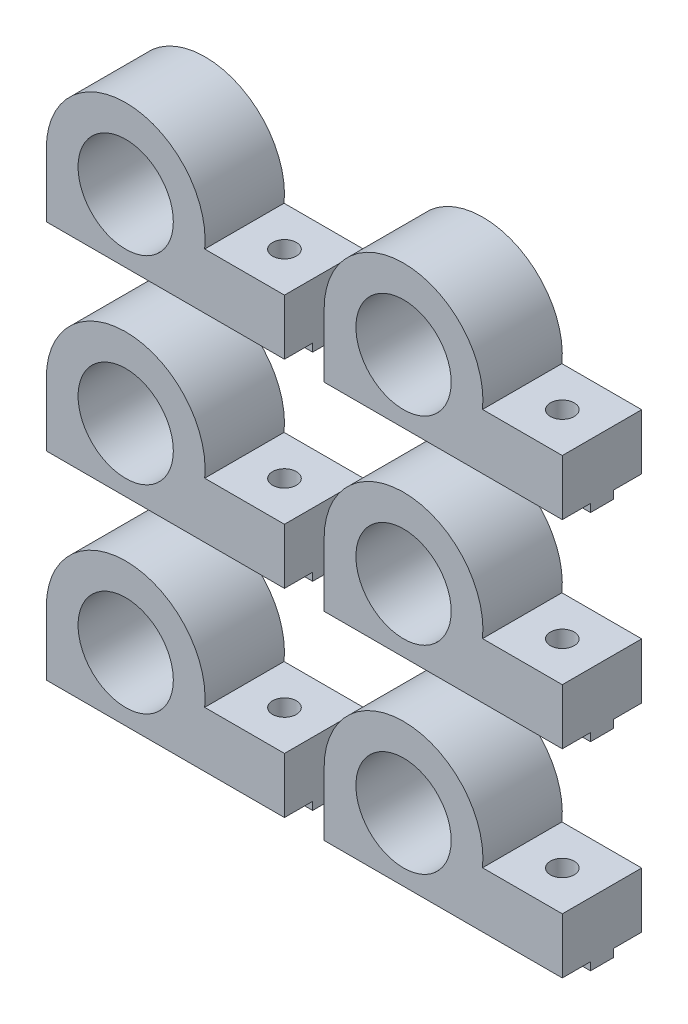
from build123d import *

# Parameters (mm, degrees)
SKETCH1_R                       = 6
MAIN_DEPTH                      = 10
SKETCH3_W                       = 30
SKETCH3_H                       = 2.9
MAKERBEAMRECTANGULARGUIDE_DEPTH = 1
SKETCH4_R                       = 1.5
MAKERBEAMFIXHOLE_DEPTH          = 25.919871589
LPATTERN1_COUNT                 = 3
LPATTERN1_PITCH                 = 25
LPATTERN1_2_COUNT               = 2
LPATTERN1_2_PITCH               = 35


with BuildPart() as part:
    # Sketch1 → Main (new body)
    with BuildSketch(Plane.XY):
        with BuildLine():
            Line((-10, 0), (-10, -8))
            Line((-10, -8), (20, -8))
            Line((20, -8), (20, -1))
            Line((20, -1), (9.949874371, -1))
            ThreePointArc((9.949874371, -1), (0.500627751, 9.987460731), (-10, 0))
        make_face()
        Circle(SKETCH1_R, mode=Mode.SUBTRACT)
    extrude(amount=MAIN_DEPTH)

    # Sketch3 → MakerBeamRectangularGuide (add)
    with BuildSketch(Plane(origin=(0, -8, 0), x_dir=(-1, 0, 0), z_dir=(0, -1, 0))):
        with Locations((-5, -5)):
            Rectangle(SKETCH3_W, SKETCH3_H)
    extrude(amount=MAKERBEAMRECTANGULARGUIDE_DEPTH)

    # Sketch4 → MakerBeamFixHole (cut, through all)
    with BuildSketch(Plane(origin=(0, -1, 0), x_dir=(1, 0, 0), z_dir=(0, 1, 0))):
        with Locations((15, -5)):
            Circle(SKETCH4_R)
    extrude(amount=-MAKERBEAMFIXHOLE_DEPTH, mode=Mode.SUBTRACT)


with BuildPart() as lpattern1_1:
    # LPattern1: pattern copy
    add(part.part.moved(Location(Vector(0, -1, 0) * (1 * LPATTERN1_PITCH))))


with BuildPart() as lpattern1_2:
    # LPattern1: pattern copy
    add(part.part.moved(Location(Vector(0, -1, 0) * (2 * LPATTERN1_PITCH))))


with BuildPart() as lpattern1_2_1:
    # LPattern1 2: pattern copy
    add(part.part.moved(Location(Vector(-1, 0, 0) * (1 * LPATTERN1_2_PITCH))))


with BuildPart() as lpattern1_2_2:
    # LPattern1 2: pattern copy
    add(lpattern1_1.part.moved(Location(Vector(-1, 0, 0) * (1 * LPATTERN1_2_PITCH))))


with BuildPart() as lpattern1_2_3:
    # LPattern1 2: pattern copy
    add(lpattern1_2.part.moved(Location(Vector(-1, 0, 0) * (1 * LPATTERN1_2_PITCH))))


solid = Compound([part.part, lpattern1_1.part, lpattern1_2.part, lpattern1_2_1.part, lpattern1_2_2.part, lpattern1_2_3.part])
